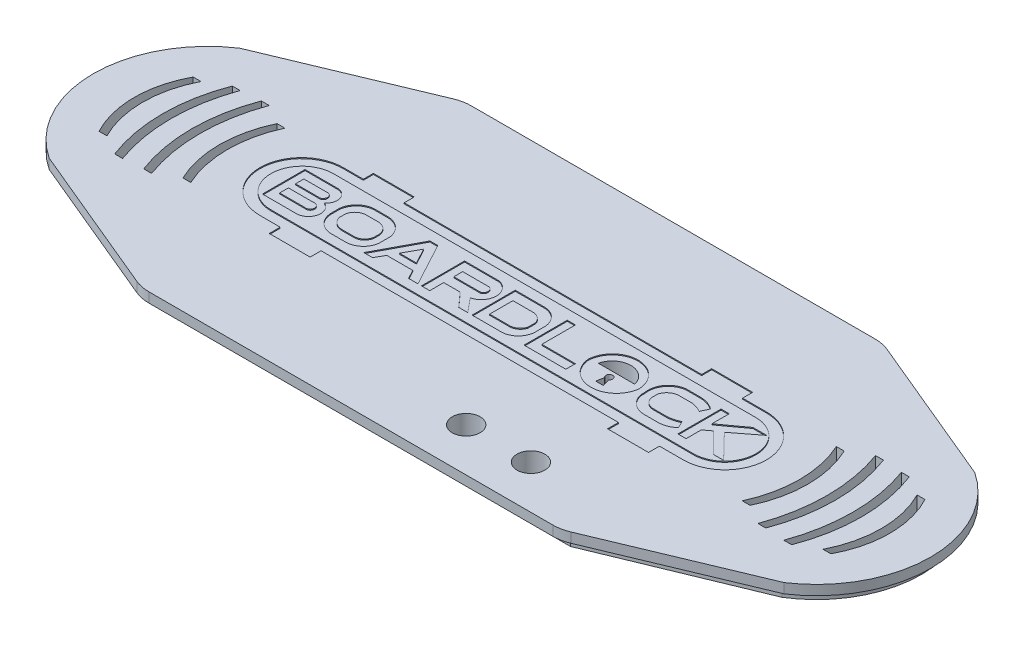
from build123d import *

# Parameters (mm, degrees)
BOSS_EXTRUDE3_DEPTH = 2.5
SKETCH2_8_R         = 3.55
BOSS_EXTRUDE4_DEPTH = 2.5
LOGO_DEPTH          = 0.25
FILLET1_R           = 10
SOUNDGAPS_REACH     = 178.856
BUTTONS_REACH       = 178.856
SKETCH5_R           = 3.55
CUT_EXTRUDE5_REACH  = 178.856


with BuildPart() as part:
    # Sketch2 → Boss-Extrude3 (new body)
    with BuildSketch(Plane(origin=(0, 0, 0), x_dir=(1, 0, 0), z_dir=(0, 1, 0))):
        with BuildLine():
            Line((-2.5, 2.5), (104.5, 2.5))
            Line((104.5, 2.5), (144.737244829, -14.291091061))
            ThreePointArc((144.737244829, -14.291091061), (157.8, -38.6), (144.737244829, -62.908908939))
            Line((144.737244829, -62.908908939), (104.5, -79.7))
            Line((104.5, -79.7), (-2.5, -79.7))
            Line((-2.5, -79.7), (-42.737244829, -62.908908939))
            ThreePointArc((-42.737244829, -62.908908939), (-55.8, -38.6), (-42.737244829, -14.291091061))
            Line((-42.737244829, -14.291091061), (-2.5, 2.5))
        make_face()
    extrude(amount=BOSS_EXTRUDE3_DEPTH)

    # Sketch2<8> → Boss-Extrude4 (add)
    with BuildSketch(Plane(origin=(0, 0, 0), x_dir=(1, 0, 0), z_dir=(0, 1, 0))):
        with BuildLine():
            Line((102, 0), (0, 0))
            Line((0, 0), (-2.5, 0))
            Line((-2.5, 0), (-40.702591635, -15.743739118))
            ThreePointArc((-40.702591635, -15.743739118), (-53.480653983, -38.6), (-40.702591635, -61.456260882))
            Line((-40.702591635, -61.456260882), (-2.5, -77.2))
            Line((-2.5, -77.2), (0, -77.2))
            Line((0, -77.2), (102, -77.2))
            Line((102, -77.2), (104.5, -77.2))
            Line((104.5, -77.2), (142.702591635, -61.456260882))
            ThreePointArc((142.702591635, -61.456260882), (155.480653983, -38.6), (142.702591635, -15.743739118))
            Line((142.702591635, -15.743739118), (104.5, 0))
            Line((104.5, 0), (102, 0))
        make_face()
        with Locations((69.32, -68.6)):
            Circle(SKETCH2_8_R, mode=Mode.SUBTRACT)
        with Locations((85.83, -68.6)):
            Circle(SKETCH2_8_R, mode=Mode.SUBTRACT)
    extrude(amount=-BOSS_EXTRUDE4_DEPTH)

    # Sketch3 → Logo (cut)
    # profile 1 of 10: a face of its own
    with BuildSketch(Plane(origin=(0, 2.5, 0), x_dir=(1, 0, 0), z_dir=(0, 1, 0))):
        with BuildLine():
            Line((1.949493887, -27.461955416), (-2.987330566, -27.461955416))
            ThreePointArc((-2.987330566, -27.461955416), (-13.803120325, -38.068295938), (-2.987330566, -48.674636459))
            Line((-2.987330566, -48.674636459), (1.949493887, -48.674636459))
            Line((1.949493887, -48.674636459), (1.949493887, -51.464582861))
            Line((1.949493887, -51.464582861), (12.371678844, -51.464582861))
            Line((12.371678844, -51.464582861), (12.371678844, -48.674636459))
            Line((12.371678844, -48.674636459), (88.239814758, -48.674636459))
            Line((88.239814758, -48.674636459), (88.239814758, -51.464582861))
            Line((88.239814758, -51.464582861), (98.688646078, -51.464582861))
            Line((98.688646078, -51.464582861), (98.688646078, -48.674636459))
            Line((98.688646078, -48.674636459), (104.624475689, -48.674636459))
            ThreePointArc((104.624475689, -48.674636459), (115.383426883, -38.068295938), (104.624475689, -27.461955416))
            Line((104.624475689, -27.461955416), (98.688646078, -27.461955416))
            Line((98.688646078, -27.461955416), (98.688646078, -24.902120515))
            Line((98.688646078, -24.902120515), (88.239814758, -24.902120515))
            Line((88.239814758, -24.902120515), (88.239814758, -27.461955416))
            Line((88.239814758, -27.461955416), (12.371678844, -27.461955416))
            Line((12.371678844, -27.461955416), (12.371678844, -24.902120515))
            Line((12.371678844, -24.902120515), (1.949493887, -24.902120515))
            Line((1.949493887, -24.902120515), (1.949493887, -27.461955416))
        make_face()
        with BuildLine():
            ThreePointArc((-3.194751797, -46.01575407), (-11.064312283, -37.938772353), (-2.987330566, -30.069211866))
            Line((-2.987330566, -30.069211866), (104.700239847, -30.069211866))
            ThreePointArc((104.700239847, -30.069211866), (112.673510949, -38.042482968), (104.700239847, -46.01575407))
            Line((104.700239847, -46.01575407), (-3.194751797, -46.01575407))
        make_face(mode=Mode.SUBTRACT)
    # profile 2 of 10: a face of its own
    with BuildSketch(Plane(origin=(0, 2.5, 0), x_dir=(1, 0, 0), z_dir=(0, 1, 0))):
        with BuildLine():
            Line((0.713326147, -32.762452382), (-7.630609586, -32.762452382))
            Line((-7.630609586, -32.762452382), (-7.630609586, -43.623173078))
            Line((-7.630609586, -43.623173078), (1.144127176, -43.623173078))
            ThreePointArc((1.144127176, -43.623173078), (4.072531045, -41.089719603), (2.23246662, -37.682653616))
            ThreePointArc((2.23246662, -37.682653616), (3.210405226, -34.686087135), (0.713326147, -32.762452382))
        make_face()
        with BuildLine():
            Line((-5.680668083, -41.17440933), (-5.680668083, -38.952382967))
            Line((-5.680668083, -38.952382967), (0.713326147, -38.952382967))
            ThreePointArc((0.713326147, -38.952382967), (2.127219592, -40.063396149), (0.713326147, -41.17440933))
            Line((0.713326147, -41.17440933), (-5.680668083, -41.17440933))
        make_face(mode=Mode.SUBTRACT)
        with BuildLine():
            Line((-5.680668083, -37.138483894), (-5.680668083, -35.007152484))
            Line((-5.680668083, -35.007152484), (0.600049584, -35.007152484))
            ThreePointArc((0.600049584, -35.007152484), (1.408506175, -36.072818189), (0.600049584, -37.138483894))
            Line((0.600049584, -37.138483894), (-5.680668083, -37.138483894))
        make_face(mode=Mode.SUBTRACT)
    # profile 3 of 10: a face of its own
    with BuildSketch(Plane(origin=(0, 2.5, 0), x_dir=(1, 0, 0), z_dir=(0, 1, 0))):
        with BuildLine():
            Line((5.346460441, -36.917426319), (5.346460441, -39.213930644))
            ThreePointArc((5.346460441, -39.213930644), (6.885943052, -42.434479638), (10.251793679, -43.623173078))
            Line((10.251793679, -43.623173078), (13.828264636, -43.623173078))
            ThreePointArc((13.828264636, -43.623173078), (16.716995574, -42.386317426), (18.096652452, -39.562999301))
            Line((18.096652452, -39.562999301), (18.096652452, -36.788822077))
            ThreePointArc((18.096652452, -36.788822077), (16.446939465, -33.787674903), (13.228063284, -32.618370223))
            Line((13.228063284, -32.618370223), (9.865980952, -32.618370223))
            ThreePointArc((9.865980952, -32.618370223), (6.816585637, -33.937769105), (5.346460441, -36.917426319))
        make_face()
        with BuildLine():
            ThreePointArc((7.340408181, -37.428569745), (8.31320862, -35.726361526), (10.137103318, -35.007152484))
            Line((10.137103318, -35.007152484), (13.346680486, -35.007152484))
            ThreePointArc((13.346680486, -35.007152484), (15.178018472, -35.715584435), (16.137891368, -37.428569745))
            Line((16.137891368, -37.428569745), (16.137891368, -38.787399969))
            ThreePointArc((16.137891368, -38.787399969), (15.339335986, -40.518029243), (13.608745934, -41.316669621))
            Line((13.608745934, -41.316669621), (10.291673968, -41.316669621))
            ThreePointArc((10.291673968, -41.316669621), (8.405132361, -40.657148151), (7.340408181, -38.965885242))
            Line((7.340408181, -38.965885242), (7.340408181, -37.428569745))
        make_face(mode=Mode.SUBTRACT)
    # profile 4 of 10: a face of its own
    with BuildSketch(Plane(origin=(0, 2.5, 0), x_dir=(1, 0, 0), z_dir=(0, 1, 0))):
        Polygon((24.087565187, -32.618370223), (18.222944768, -43.623173078), (20.462903956, -43.623173078), (21.766152938, -41.316669621), (28.404577439, -41.316669621), (29.646736625, -43.623173078), (32.02923867, -43.623173078), (26.102641459, -32.618370223), align=None)
        Polygon((27.243871315, -39.213930644), (22.906495797, -39.213930644), (25.095103323, -35.2239905), align=None, mode=Mode.SUBTRACT)
    # profile 5 of 10: a face of its own
    with BuildSketch(Plane(origin=(0, 2.5, 0), x_dir=(1, 0, 0), z_dir=(0, 1, 0))):
        with BuildLine():
            Line((41.793638287, -32.618370223), (32.928013354, -32.618370223))
            Line((32.928013354, -32.618370223), (32.928013354, -43.623173078))
            Line((32.928013354, -43.623173078), (35.04301538, -43.623173078))
            Line((35.04301538, -43.623173078), (35.04301538, -40.063396149))
            Line((35.04301538, -40.063396149), (39.244046803, -40.063396149))
            Line((39.244046803, -40.063396149), (42.431036158, -43.623173078))
            Line((42.431036158, -43.623173078), (44.737782461, -43.623173078))
            Line((44.737782461, -43.623173078), (41.793638287, -40.063396149))
            ThreePointArc((41.793638287, -40.063396149), (44.733866299, -36.340883186), (41.793638287, -32.618370223))
        make_face()
        with BuildLine():
            Line((35.04301538, -37.48051524), (35.04301538, -35.2239905))
            Line((35.04301538, -35.2239905), (41.793638287, -35.2239905))
            ThreePointArc((41.793638287, -35.2239905), (42.65693054, -36.35225287), (41.793638287, -37.48051524))
            Line((41.793638287, -37.48051524), (35.04301538, -37.48051524))
        make_face(mode=Mode.SUBTRACT)
    # profile 6 of 10: a face of its own
    with BuildSketch(Plane(origin=(0, 2.5, 0), x_dir=(1, 0, 0), z_dir=(0, 1, 0))):
        with BuildLine():
            Line((52.968722487, -32.618370223), (45.846335848, -32.618370223))
            Line((45.846335848, -32.618370223), (45.846335848, -43.623173078))
            Line((45.846335848, -43.623173078), (52.83287315, -43.623173078))
            ThreePointArc((52.83287315, -43.623173078), (56.080236632, -42.589880341), (57.64582107, -39.562999301))
            Line((57.64582107, -39.562999301), (57.64582107, -36.788822077))
            ThreePointArc((57.64582107, -36.788822077), (56.171000638, -33.734937317), (52.968722487, -32.618370223))
        make_face()
        with BuildLine():
            Line((47.864668846, -41.17440933), (47.864668846, -35.2239905))
            Line((47.864668846, -35.2239905), (52.599988574, -35.2239905))
            ThreePointArc((52.599988574, -35.2239905), (54.440160348, -35.663250015), (55.624586826, -37.138483894))
            Line((55.624586826, -37.138483894), (55.624586826, -39.18661223))
            ThreePointArc((55.624586826, -39.18661223), (54.462155657, -40.712863912), (52.599988574, -41.17440933))
            Line((52.599988574, -41.17440933), (47.864668846, -41.17440933))
        make_face(mode=Mode.SUBTRACT)
    # profile 7 of 10: a face of its own
    with BuildSketch(Plane(origin=(0, 2.5, 0), x_dir=(1, 0, 0), z_dir=(0, 1, 0))):
        Polygon((61.195413218, -32.618370223), (59.109629375, -32.618370223), (59.109629375, -43.623173078), (69.752475136, -43.623173078), (69.752475136, -41.187576484), (61.195413218, -41.187576484), align=None)
    # profile 8 of 10: a face of its own
    with BuildSketch(Plane(origin=(0, 2.5, 0), x_dir=(1, 0, 0), z_dir=(0, 1, 0))):
        with BuildLine():
            ThreePointArc((86.967057925, -37.33302991), (88.24698918, -35.587564651), (90.332173753, -35.007152484))
            Line((90.332173753, -35.007152484), (93.354874286, -35.007152484))
            ThreePointArc((93.354874286, -35.007152484), (94.768458464, -35.327728442), (96.082389221, -35.939753883))
            Line((96.082389221, -35.939753883), (96.979753441, -33.956106658))
            ThreePointArc((96.979753441, -33.956106658), (95.096667996, -32.952004021), (92.988844144, -32.618370223))
            Line((92.988844144, -32.618370223), (89.529268924, -32.618370223))
            ThreePointArc((89.529268924, -32.618370223), (85.927201794, -34.605805074), (84.941711164, -38.6))
            Line((84.941711164, -38.6), (84.941711164, -39.513929713))
            ThreePointArc((84.941711164, -39.513929713), (86.739352365, -42.572399213), (90.127806859, -43.623173078))
            Line((90.127806859, -43.623173078), (93.049792527, -43.623173078))
            ThreePointArc((93.049792527, -43.623173078), (95.178031827, -43.279186153), (97.039888867, -42.192347671))
            Line((97.039888867, -42.192347671), (96.15967403, -40.380436784))
            ThreePointArc((96.15967403, -40.380436784), (94.749505142, -40.914672607), (93.266431414, -41.187576484))
            Line((93.266431414, -41.187576484), (89.766541153, -41.187576484))
            ThreePointArc((89.766541153, -41.187576484), (87.98359415, -40.626914615), (86.967057925, -39.058509102))
            Line((86.967057925, -39.058509102), (86.967057925, -37.33302991))
        make_face()
    # profile 9 of 10: a face of its own
    with BuildSketch(Plane(origin=(0, 2.5, 0), x_dir=(1, 0, 0), z_dir=(0, 1, 0))):
        Polygon((100.433477861, -32.619456407), (98.346127272, -32.619456407), (98.346127272, -43.625930338), (100.433477861, -43.625930338), (100.433477861, -39.738654566), (102.223113581, -38.43184366), (107.375394287, -43.625930338), (110.007271118, -43.625930338), (103.904039503, -37.33302991), (110.007271118, -32.619456407), (106.490539146, -32.619456407), (100.433477861, -37.042386537), align=None)
    # profile 10 of 10: a face of its own
    with BuildSketch(Plane(origin=(0, 2.5, 0), x_dir=(1, 0, 0), z_dir=(0, 1, 0))):
        with BuildLine():
            ThreePointArc((83.440446503, -38.6), (76.914090873, -32.366505687), (70.387735243, -38.6))
            ThreePointArc((70.387735243, -38.6), (76.914090873, -44.419626268), (83.440446503, -38.6))
        make_face()
        with BuildLine():
            Line((75.957169691, -42.192347671), (76.285044547, -40.252788166))
            ThreePointArc((76.285044547, -40.252788166), (76.809249819, -38.728957059), (77.33345509, -40.252788166))
            Line((77.33345509, -40.252788166), (77.846095102, -42.192347671))
            Line((77.846095102, -42.192347671), (75.957169691, -42.192347671))
        make_face(mode=Mode.SUBTRACT)
        with BuildLine():
            Line((81.605728053, -37.905608877), (72.327294748, -37.905608877))
            ThreePointArc((72.327294748, -37.905608877), (76.9665114, -34.227223026), (81.605728053, -37.905608877))
        make_face(mode=Mode.SUBTRACT)
    extrude(amount=-LOGO_DEPTH, mode=Mode.SUBTRACT)

    # Fillet1
    fillet1_edges = [part.edges().sort_by_distance(p)[0] for p in [
        (-2.5, 1.25, -2.5),
        (104.5, 1.25, -2.5),
        (104.5, 1.25, 79.7),
        (-2.5, 1.25, 79.7),
    ]]
    fillet(fillet1_edges, radius=FILLET1_R)

    # Sketch4 → SoundGaps (cut, up to next)
    with BuildSketch(Plane(origin=(0, 2.5, 0), x_dir=(1, 0, 0), z_dir=(0, 1, 0)), mode=Mode.PRIVATE) as soundgaps_sk1:
        with BuildLine():
            Line((-42.336442958, -26.6), (-40.336442958, -26.6))
            ThreePointArc((-40.336442958, -26.6), (-43.210098634, -38.6), (-40.336442958, -50.6))
            Line((-40.336442958, -50.6), (-42.336442958, -50.6))
            ThreePointArc((-42.336442958, -50.6), (-45.345121926, -38.6), (-42.336442958, -26.6))
        make_face()
    soundgaps_tool1 = extrude(soundgaps_sk1.sketch, amount=-SOUNDGAPS_REACH, mode=Mode.PRIVATE) & part.part
    # Sketch4 → SoundGaps (cut, up to next)
    with BuildSketch(Plane(origin=(0, 2.5, 0), x_dir=(1, 0, 0), z_dir=(0, 1, 0)), mode=Mode.PRIVATE) as soundgaps_sk2:
        with BuildLine():
            Line((-35.336442958, -53.6), (-33.336442958, -53.6))
            ThreePointArc((-33.336442958, -53.6), (-35.959167646, -38.6), (-33.336442958, -23.6))
            Line((-33.336442958, -23.6), (-35.336442958, -23.6))
            ThreePointArc((-35.336442958, -23.6), (-38.112185635, -38.6), (-35.336442958, -53.6))
        make_face()
    soundgaps_tool2 = extrude(soundgaps_sk2.sketch, amount=-SOUNDGAPS_REACH, mode=Mode.PRIVATE) & part.part
    # Sketch4 → SoundGaps (cut, up to next)
    with BuildSketch(Plane(origin=(0, 2.5, 0), x_dir=(1, 0, 0), z_dir=(0, 1, 0)), mode=Mode.PRIVATE) as soundgaps_sk3:
        with BuildLine():
            Line((-28.336442958, -23.2), (-26.336442958, -23.2))
            ThreePointArc((-26.336442958, -23.2), (-28.980435332, -38.2), (-26.336442958, -53.2))
            Line((-26.336442958, -53.2), (-28.336442958, -53.2))
            ThreePointArc((-28.336442958, -53.2), (-31.075866522, -38.2), (-28.336442958, -23.2))
        make_face()
    soundgaps_tool3 = extrude(soundgaps_sk3.sketch, amount=-SOUNDGAPS_REACH, mode=Mode.PRIVATE) & part.part
    # Sketch4 → SoundGaps (cut, up to next)
    with BuildSketch(Plane(origin=(0, 2.5, 0), x_dir=(1, 0, 0), z_dir=(0, 1, 0)), mode=Mode.PRIVATE) as soundgaps_sk4:
        with BuildLine():
            Line((-21.336442958, -50.2), (-19.336442958, -50.2))
            ThreePointArc((-19.336442958, -50.2), (-21.944289857, -38.2), (-19.336442958, -26.2))
            Line((-19.336442958, -26.2), (-21.336442958, -26.2))
            ThreePointArc((-21.336442958, -26.2), (-24.039371453, -38.2), (-21.336442958, -50.2))
        make_face()
    soundgaps_tool4 = extrude(soundgaps_sk4.sketch, amount=-SOUNDGAPS_REACH, mode=Mode.PRIVATE) & part.part
    # Sketch4 → SoundGaps (cut, up to next)
    with BuildSketch(Plane(origin=(0, 2.5, 0), x_dir=(1, 0, 0), z_dir=(0, 1, 0)), mode=Mode.PRIVATE) as soundgaps_sk5:
        with BuildLine():
            Line((123.336442958, -26.2), (121.336442958, -26.2))
            ThreePointArc((121.336442958, -26.2), (123.944289857, -38.2), (121.336442958, -50.2))
            Line((121.336442958, -50.2), (123.336442958, -50.2))
            ThreePointArc((123.336442958, -50.2), (126.039371453, -38.2), (123.336442958, -26.2))
        make_face()
    soundgaps_tool5 = extrude(soundgaps_sk5.sketch, amount=-SOUNDGAPS_REACH, mode=Mode.PRIVATE) & part.part
    # Sketch4 → SoundGaps (cut, up to next)
    with BuildSketch(Plane(origin=(0, 2.5, 0), x_dir=(1, 0, 0), z_dir=(0, 1, 0)), mode=Mode.PRIVATE) as soundgaps_sk6:
        with BuildLine():
            Line((130.336442958, -53.2), (128.336442958, -53.2))
            ThreePointArc((128.336442958, -53.2), (130.980435332, -38.2), (128.336442958, -23.2))
            Line((128.336442958, -23.2), (130.336442958, -23.2))
            ThreePointArc((130.336442958, -23.2), (133.075866522, -38.2), (130.336442958, -53.2))
        make_face()
    soundgaps_tool6 = extrude(soundgaps_sk6.sketch, amount=-SOUNDGAPS_REACH, mode=Mode.PRIVATE) & part.part
    # Sketch4 → SoundGaps (cut, up to next)
    with BuildSketch(Plane(origin=(0, 2.5, 0), x_dir=(1, 0, 0), z_dir=(0, 1, 0)), mode=Mode.PRIVATE) as soundgaps_sk7:
        with BuildLine():
            Line((137.336442958, -23.6), (135.336442958, -23.6))
            ThreePointArc((135.336442958, -23.6), (137.959167646, -38.6), (135.336442958, -53.6))
            Line((135.336442958, -53.6), (137.336442958, -53.6))
            ThreePointArc((137.336442958, -53.6), (140.112185635, -38.6), (137.336442958, -23.6))
        make_face()
    soundgaps_tool7 = extrude(soundgaps_sk7.sketch, amount=-SOUNDGAPS_REACH, mode=Mode.PRIVATE) & part.part
    # Sketch4 → SoundGaps (cut, up to next)
    with BuildSketch(Plane(origin=(0, 2.5, 0), x_dir=(1, 0, 0), z_dir=(0, 1, 0)), mode=Mode.PRIVATE) as soundgaps_sk8:
        with BuildLine():
            Line((144.336442958, -50.6), (142.336442958, -50.6))
            ThreePointArc((142.336442958, -50.6), (145.210098634, -38.6), (142.336442958, -26.6))
            Line((142.336442958, -26.6), (144.336442958, -26.6))
            ThreePointArc((144.336442958, -26.6), (147.345121926, -38.6), (144.336442958, -50.6))
        make_face()
    soundgaps_tool8 = extrude(soundgaps_sk8.sketch, amount=-SOUNDGAPS_REACH, mode=Mode.PRIVATE) & part.part
    add(soundgaps_tool1.solids().sort_by_distance((-43.336866, 2.5, 38.6))[0], mode=Mode.SUBTRACT)
    add(soundgaps_tool2.solids().sort_by_distance((-36.164676, 2.5, 38.6))[0], mode=Mode.SUBTRACT)
    add(soundgaps_tool3.solids().sort_by_distance((-29.153278, 2.5, 38.2))[0], mode=Mode.SUBTRACT)
    add(soundgaps_tool4.solids().sort_by_distance((-22.134482, 2.5, 38.2))[0], mode=Mode.SUBTRACT)
    add(soundgaps_tool5.solids().sort_by_distance((124.134482, 2.5, 38.2))[0], mode=Mode.SUBTRACT)
    add(soundgaps_tool6.solids().sort_by_distance((131.153278, 2.5, 38.2))[0], mode=Mode.SUBTRACT)
    add(soundgaps_tool7.solids().sort_by_distance((138.164676, 2.5, 38.6))[0], mode=Mode.SUBTRACT)
    add(soundgaps_tool8.solids().sort_by_distance((145.336866, 2.5, 38.6))[0], mode=Mode.SUBTRACT)

    # Sketch5 → Buttons (cut, up to next)
    with BuildSketch(Plane(origin=(0, 2.5, 0), x_dir=(1, 0, 0), z_dir=(0, 1, 0)), mode=Mode.PRIVATE) as buttons_sk1:
        with Locations((69.32, -68.6)):
            Circle(SKETCH5_R)
    buttons_tool1 = extrude(buttons_sk1.sketch, amount=-BUTTONS_REACH, mode=Mode.PRIVATE) & part.part
    # Sketch5 → Buttons (cut, up to next)
    with BuildSketch(Plane(origin=(0, 2.5, 0), x_dir=(1, 0, 0), z_dir=(0, 1, 0)), mode=Mode.PRIVATE) as buttons_sk2:
        with Locations((85.83, -68.6)):
            Circle(SKETCH5_R)
    buttons_tool2 = extrude(buttons_sk2.sketch, amount=-BUTTONS_REACH, mode=Mode.PRIVATE) & part.part
    add(buttons_tool1.solids().sort_by_distance((69.32, 2.5, 68.6))[0], mode=Mode.SUBTRACT)
    add(buttons_tool2.solids().sort_by_distance((85.83, 2.5, 68.6))[0], mode=Mode.SUBTRACT)

    # Sketch3<5> → Cut-Extrude5 (cut, up to next)
    with BuildSketch(Plane(origin=(0, 2.5, 0), x_dir=(1, 0, 0), z_dir=(0, 1, 0)), mode=Mode.PRIVATE) as cut_extrude5_sk1:
        with BuildLine():
            ThreePointArc((81.605728053, -37.905608877), (76.9665114, -34.227223026), (72.327294748, -37.905608877))
            Line((72.327294748, -37.905608877), (81.605728053, -37.905608877))
        make_face()
    cut_extrude5_tool1 = extrude(cut_extrude5_sk1.sketch, amount=-CUT_EXTRUDE5_REACH, mode=Mode.PRIVATE) & part.part
    # Sketch3<5> → Cut-Extrude5 (cut, up to next)
    with BuildSketch(Plane(origin=(0, 2.5, 0), x_dir=(1, 0, 0), z_dir=(0, 1, 0)), mode=Mode.PRIVATE) as cut_extrude5_sk2:
        with BuildLine():
            ThreePointArc((77.33345509, -40.252788166), (76.809249819, -38.728957059), (76.285044547, -40.252788166))
            Line((76.285044547, -40.252788166), (75.957169691, -42.192347671))
            Line((75.957169691, -42.192347671), (77.846095102, -42.192347671))
            Line((77.846095102, -42.192347671), (77.33345509, -40.252788166))
        make_face()
    cut_extrude5_tool2 = extrude(cut_extrude5_sk2.sketch, amount=-CUT_EXTRUDE5_REACH, mode=Mode.PRIVATE) & part.part
    add(cut_extrude5_tool1.solids().sort_by_distance((76.966511, 2.5, 36.371206))[0], mode=Mode.SUBTRACT)
    add(cut_extrude5_tool2.solids().sort_by_distance((76.838073, 2.5, 40.549632))[0], mode=Mode.SUBTRACT)


solid = part.part
